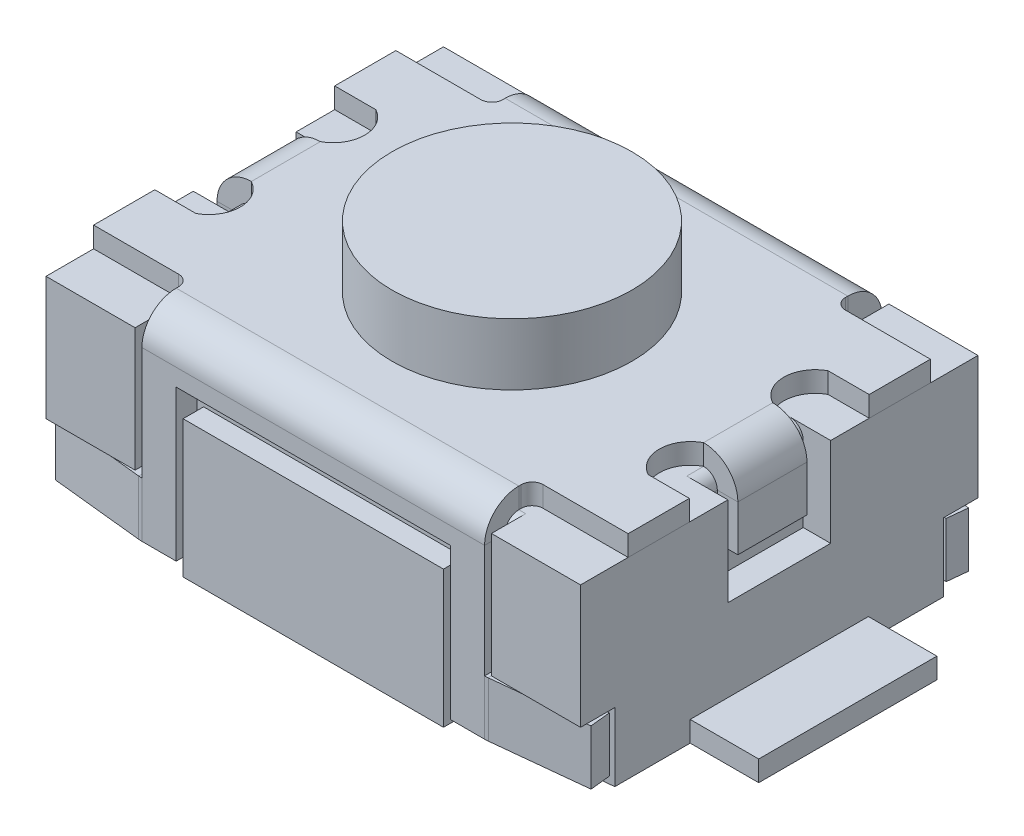
from build123d import *
from OCP.BRepFilletAPI import BRepFilletAPI_MakeChamfer

# Parameters (mm, degrees)
SKETCH1_W                   = 3.9
SKETCH1_H                   = 2.9
BOSS_EXTRUDE1_DEPTH         = 1.4
SKETCH2_R                   = 0.875
BOSS_EXTRUDE2_DEPTH         = 0.6
SKETCH3_W                   = 1
SKETCH3_H                   = 0.5
CUT_EXTRUDE1_DEPTH          = 0.15
CHAMFER1_SIZE               = 0.1
CHAMFER1_SIZE_2             = 1
CHAMFER2_SIZE               = 1
CHAMFER2_SIZE_2             = 0.1
CUT_EXTRUDE_DEPTH           = 0.15
SKETCH5_W                   = 0.4
SKETCH5_H                   = 0.75
CUT_EXTRUDE2_DEPTH          = 0.65
FILLET1_R                   = 0.1
BOSS_EXTRUDE3_DEPTH         = 0.15
SKETCHED_START              = -1.25
SKETCHED_BEND1_DEPTH        = 2.5
SKETCHED_START_2            = -1.95
SKETCHED_BEND1_2_OUTLINE_W  = 0.4
SKETCHED_BEND1_2_OUTLINE_H  = 0.15
SKETCHED_BEND1_2_DEPTH      = 0.95
SKETCHED_START_3            = 1
SKETCHED_BEND1_3_OUTLINE_W  = 0.4
SKETCHED_BEND1_3_OUTLINE_H  = 0.15
SKETCHED_BEND1_3_DEPTH      = 0.95
SKETCHED_BEND1_4_OUTLINE_W  = 0.7
SKETCHED_BEND1_4_OUTLINE_H  = 0.15
SKETCHED_BEND1_4_DEPTH      = 0.25
SKETCHED_BEND1_5_OUTLINE_W  = 0.7
SKETCHED_BEND1_5_OUTLINE_H  = 0.15
SKETCHED_BEND1_5_DEPTH      = 0.25
SKETCHED_START_4            = -0.252028138
SKETCHED_BEND1_6_DEPTH      = 0.504056276
SKETCHED_BEND1_7_DEPTH      = 3.9
SKETCHED_START_5            = -2.258673163
SKETCHED_BEND1_8_OUTLINE_W  = 0.15
SKETCHED_BEND1_8_OUTLINE_H  = 0.504056276
SKETCHED_BEND1_8_DEPTH      = 0.358673163
SKETCHED_START_6            = 1.9
SKETCHED_BEND1_9_OUTLINE_W  = 0.15
SKETCHED_BEND1_9_OUTLINE_H  = 0.504056276
SKETCHED_BEND1_9_DEPTH      = 0.358673163
SKETCHED_START_7            = -2.7
SKETCHED_BEND1_10_OUTLINE_W = 3.9
SKETCHED_BEND1_10_OUTLINE_H = 0.15
SKETCHED_BEND1_10_DEPTH     = 1.25
SKETCHED_START_8            = 1.45
SKETCHED_BEND1_11_OUTLINE_W = 3.9
SKETCHED_BEND1_11_OUTLINE_H = 0.15
SKETCHED_BEND1_11_DEPTH     = 1.25
SKETCHED_BEND1_12_DEPTH     = 0.504056276
SKETCHED_START_9            = 0.074889357
SKETCHED_BEND6_DEPTH        = 0.4
SKETCHED_BEND6_2_DEPTH      = 0.4
SKETCHED_BEND3_DEPTH        = 0.4
SKETCHED_BEND3_2_DEPTH      = 0.4
SKETCH10_W                  = 0.5
SKETCH10_H                  = 1.3
CUT_EXTRUDE3_DEPTH          = 0.15
SKETCH11_W                  = 0.75
SKETCH11_H                  = 1.3
BOSS_EXTRUDE4_DEPTH         = 0.15
BOSS_EXTRUDE4_2_DEPTH       = 0.15


# Read off the part's stored shape, not the designer's step: Sketched Bend1, Sketched Bend6, Sketched Bend3
# Some blends are built 0.0001 mm under size
with BuildPart() as part:
    # Sketch1 → Boss-Extrude1 (new body)
    with BuildSketch(Plane(origin=(0, 0, 0), x_dir=(1, 0, 0), z_dir=(0, 1, 0))):
        Rectangle(SKETCH1_W, SKETCH1_H)
    extrude(amount=BOSS_EXTRUDE1_DEPTH)

    # Sketch2 → Boss-Extrude2 (add)
    with BuildSketch(Plane(origin=(0, 1.4, 0), x_dir=(1, 0, 0), z_dir=(0, 1, 0))):
        with Locations(Location((0, 0, 0), (0, 0, 90))):
            Circle(SKETCH2_R)
    extrude(amount=BOSS_EXTRUDE2_DEPTH)

    # Sketch3 → Cut-Extrude1 (cut)
    with BuildSketch(Plane.XY.offset(1.45)):
        with Locations((1.45, 0.25)):
            Rectangle(SKETCH3_W, SKETCH3_H)
        with Locations((-1.45, 0.25)):
            Rectangle(SKETCH3_W, SKETCH3_H)
    cut_extrude1 = extrude(amount=-CUT_EXTRUDE1_DEPTH, mode=Mode.SUBTRACT)

    # Mirror1: Cut-Extrude1 across plane
    add(cut_extrude1.mirror(Plane.XY), mode=Mode.SUBTRACT)

    # Chamfer1
    # the kernel refuses this chamfer: 1, 0.1 mm, written as the material it takes off along each edge
    with BuildSketch(Plane(origin=(1.95, 0.5, 1.3), x_dir=(0.3574851447578448, 0, -0.9339188247794681), z_dir=(0, -1, 0))) as chamfer1_piece_1:
        Polygon((CHAMFER1_SIZE * 0.933918824779, -CHAMFER1_SIZE * 0.357485144758), (-CHAMFER1_SIZE_2 * 0.357485144758, -CHAMFER1_SIZE_2 * 0.933918824779), (0, 0), align=None)
    extrude(amount=3.099522763, mode=Mode.SUBTRACT)
    with BuildSketch(Plane(origin=(-1.95, 0.5, 1.3), x_dir=(-0.3574851447578448, 0, -0.9339188247794681), z_dir=(0, -1, 0))) as chamfer1_piece_2:
        Polygon((CHAMFER1_SIZE * 0.933918824779, CHAMFER1_SIZE * 0.357485144758), (-CHAMFER1_SIZE_2 * 0.357485144758, CHAMFER1_SIZE_2 * 0.933918824779), (0, 0), align=None)
    extrude(amount=3.099522763, mode=Mode.SUBTRACT)

    # Chamfer2
    chamfer2_edges_1 = [part.edges().sort_by_distance(p)[0] for p in [
        (1.95, 0.25, -1.3),
    ]]
    chamfer2_side_1 = [part.faces().sort_by_distance(p)[0] for p in [
        (1.948, 0.25, -1.3),
    ]]
    chamfer2_edges_2 = [part.edges().sort_by_distance(p)[0] for p in [
        (-1.95, 0.25, -1.3),
    ]]
    chamfer2_side_2 = [part.faces().sort_by_distance(p)[0] for p in [
        (-1.95, 0.25, -1.298),
    ]]
    chamfer2 = BRepFilletAPI_MakeChamfer(part.part.solid().wrapped)
    for e in chamfer2_edges_1:
        chamfer2.Add(CHAMFER2_SIZE - 0.0001, CHAMFER2_SIZE_2 - 0.0001, e.wrapped, chamfer2_side_1[0].wrapped)
    for e in chamfer2_edges_2:
        chamfer2.Add(CHAMFER2_SIZE_2 - 0.0001, CHAMFER2_SIZE - 0.0001, e.wrapped, chamfer2_side_2[0].wrapped)
    add(Compound.cast(chamfer2.Shape()), mode=Mode.REPLACE)  # a hair under: the kernel refuses the full size

    # Sketch4 → Cut-Extrude (cut)
    with BuildSketch(Plane.XY.offset(1.45)):
        Polygon((-1.3, 1.4), (1.3, 1.4), (1.3, 0.5), (0.95, 0.5), (0.95, 1), (-0.95, 1), (-0.95, 0.5), (-1.3, 0.5), align=None)
    cut_extrude = extrude(amount=-CUT_EXTRUDE_DEPTH, mode=Mode.SUBTRACT)

    # Mirror6: Cut-Extrude across plane
    add(cut_extrude.mirror(Plane.XY), mode=Mode.SUBTRACT)

    # Sketch5 → Cut-Extrude2 (cut)
    with BuildSketch(Plane(origin=(0, 1.4, 0), x_dir=(1, 0, 0), z_dir=(0, 1, 0))):
        with Locations((-1.95, 0)):
            Rectangle(SKETCH5_W, SKETCH5_H)
    cut_extrude2 = extrude(amount=-CUT_EXTRUDE2_DEPTH, mode=Mode.SUBTRACT)

    # Mirror2: Cut-Extrude2 across plane
    add(cut_extrude2.mirror(Plane(origin=(0, 0, 0), x_dir=(0, 0, 1), z_dir=(1, 0, 0))), mode=Mode.SUBTRACT)

    # Fillet1
    fillet1_edges = [part.edges().sort_by_distance(p)[0] for p in [
        (0, 1.4, 1.3),
        (0, 1.4, -1.3),
        (-1.75, 1.4, 0),
        (1.75, 1.4, 0),
    ]]
    fillet(fillet1_edges, radius=FILLET1_R)

    # Sketch10 → Cut-Extrude3 (cut)
    with BuildSketch(Plane(origin=(0, 0, 0), x_dir=(-1, 0, 0), z_dir=(0, -1, 0))):
        with Locations((1.95, 0)):
            Rectangle(SKETCH10_W, SKETCH10_H)
        with Locations((-1.95, 0)):
            Rectangle(SKETCH10_W, SKETCH10_H)
    extrude(amount=-CUT_EXTRUDE3_DEPTH, mode=Mode.SUBTRACT)


with BuildPart() as body_2:
    # Sketch6 → Boss-Extrude3 (new body)
    with BuildSketch(Plane(origin=(0, 1.4, 0), x_dir=(1, 0, 0), z_dir=(0, 1, 0))):
        with BuildLine():
            Line((1.25, 1.2), (1.25, 2.3))
            Line((1.25, 2.3), (1.95, 2.3))
            Line((1.95, 2.3), (1.95, 2.7))
            Line((1.95, 2.7), (1, 2.7))
            Line((1, 2.7), (1, 1.6))
            Line((1, 1.6), (-1, 1.6))
            Line((-1, 1.6), (-1, 2.7))
            Line((-1, 2.7), (-1.95, 2.7))
            Line((-1.95, 2.7), (-1.95, 2.3))
            Line((-1.95, 2.3), (-1.25, 2.3))
            Line((-1.25, 2.3), (-1.25, 1.2))
            Line((-1.25, 1.2), (-1.25, 1.182641483))
            ThreePointArc((-1.25, 1.182641483), (-1.273431458, 1.126072941), (-1.33, 1.102641483))
            Line((-1.33, 1.102641483), (-1.95, 1.102641483))
            Line((-1.95, 1.102641483), (-1.95, 0.656190297))
            Line((-1.95, 0.656190297), (-1.65, 0.656190297))
            ThreePointArc((-1.65, 0.656190297), (-1.528818532, 0.454109218), (-1.65, 0.252028138))
            Line((-1.65, 0.252028138), (-2.258673163, 0.252028138))
            Line((-2.258673163, 0.252028138), (-2.258673163, -0.252028138))
            Line((-2.258673163, -0.252028138), (-1.65, -0.252028138))
            ThreePointArc((-1.65, -0.252028138), (-1.528818532, -0.454109218), (-1.65, -0.656190297))
            Line((-1.65, -0.656190297), (-1.95, -0.656190297))
            Line((-1.95, -0.656190297), (-1.95, -1.102641483))
            Line((-1.95, -1.102641483), (-1.33, -1.102641483))
            ThreePointArc((-1.33, -1.102641483), (-1.273431458, -1.126072941), (-1.25, -1.182641483))
            Line((-1.25, -1.182641483), (-1.25, -1.2))
            Line((-1.25, -1.2), (-1.25, -2.3))
            Line((-1.25, -2.3), (-1.95, -2.3))
            Line((-1.95, -2.3), (-1.95, -2.7))
            Line((-1.95, -2.7), (-1, -2.7))
            Line((-1, -2.7), (-1, -1.6))
            Line((-1, -1.6), (1, -1.6))
            Line((1, -1.6), (1, -2.7))
            Line((1, -2.7), (1.95, -2.7))
            Line((1.95, -2.7), (1.95, -2.3))
            Line((1.95, -2.3), (1.25, -2.3))
            Line((1.25, -2.3), (1.25, -1.2))
            Line((1.25, -1.2), (1.25, -1.182641483))
            ThreePointArc((1.25, -1.182641483), (1.273431458, -1.126072941), (1.33, -1.102641483))
            Line((1.33, -1.102641483), (1.95, -1.102641483))
            Line((1.95, -1.102641483), (1.95, -0.656190297))
            Line((1.95, -0.656190297), (1.65, -0.656190297))
            ThreePointArc((1.65, -0.656190297), (1.528818532, -0.454109218), (1.65, -0.252028138))
            Line((1.65, -0.252028138), (2.258673163, -0.252028138))
            Line((2.258673163, -0.252028138), (2.258673163, 0.252028138))
            Line((2.258673163, 0.252028138), (1.65, 0.252028138))
            ThreePointArc((1.65, 0.252028138), (1.528818532, 0.454109218), (1.65, 0.656190297))
            Line((1.65, 0.656190297), (1.95, 0.656190297))
            Line((1.95, 0.656190297), (1.95, 1.102641483))
            Line((1.95, 1.102641483), (1.33, 1.102641483))
            ThreePointArc((1.33, 1.102641483), (1.273431458, 1.126072941), (1.25, 1.182641483))
            Line((1.25, 1.182641483), (1.25, 1.2))
        make_face()
    extrude(amount=BOSS_EXTRUDE3_DEPTH)

    # Sketched Bend1 outline → Sketched Bend1 (add)
    with BuildSketch(Plane.YZ.offset(SKETCHED_START)):
        with BuildLine():
            Line((1.4, 1.2), (1.4, 1.429128784))
            ThreePointArc((1.4, 1.429128784), (1.351077411, 1.444726578), (1.3, 1.45))
            Line((1.3, 1.45), (1.174889357, 1.45))
            Line((1.174889357, 1.45), (1.174889357, 1.3))
            Line((1.174889357, 1.3), (1.3, 1.3))
            ThreePointArc((1.3, 1.3), (1.370710678, 1.270710678), (1.4, 1.2))
        make_face()
        with BuildLine():
            Line((1.4, -1.429128784), (1.4, -1.2))
            ThreePointArc((1.4, -1.2), (1.370710678, -1.270710678), (1.3, -1.3))
            Line((1.3, -1.3), (1.174889357, -1.3))
            Line((1.174889357, -1.3), (1.174889357, -1.45))
            Line((1.174889357, -1.45), (1.3, -1.45))
            ThreePointArc((1.3, -1.45), (1.351077411, -1.444726578), (1.4, -1.429128784))
        make_face()
    extrude(amount=SKETCHED_BEND1_DEPTH)

    # Sketched Bend1 2 outline → Sketched Bend1 2 (add)
    with BuildSketch(Plane.YZ.offset(SKETCHED_START_2)):
        with Locations((0.274889357, 1.375)):
            Rectangle(SKETCHED_BEND1_2_OUTLINE_W, SKETCHED_BEND1_2_OUTLINE_H)
        with Locations((0.274889357, -1.375)):
            Rectangle(SKETCHED_BEND1_2_OUTLINE_W, SKETCHED_BEND1_2_OUTLINE_H)
    extrude(amount=SKETCHED_BEND1_2_DEPTH)

    # Sketched Bend1 3 outline → Sketched Bend1 3 (add)
    with BuildSketch(Plane.YZ.offset(SKETCHED_START_3)):
        with Locations((0.274889357, 1.375)):
            Rectangle(SKETCHED_BEND1_3_OUTLINE_W, SKETCHED_BEND1_3_OUTLINE_H)
        with Locations((0.274889357, -1.375)):
            Rectangle(SKETCHED_BEND1_3_OUTLINE_W, SKETCHED_BEND1_3_OUTLINE_H)
    extrude(amount=SKETCHED_BEND1_3_DEPTH)

    # Sketched Bend1 4 outline → Sketched Bend1 4 (add)
    with BuildSketch(Plane.YZ.offset(SKETCHED_START)):
        with Locations((0.824889357, 1.375)):
            Rectangle(SKETCHED_BEND1_4_OUTLINE_W, SKETCHED_BEND1_4_OUTLINE_H)
        with Locations((0.824889357, -1.375)):
            Rectangle(SKETCHED_BEND1_4_OUTLINE_W, SKETCHED_BEND1_4_OUTLINE_H)
    extrude(amount=SKETCHED_BEND1_4_DEPTH)

    # Sketched Bend1 5 outline → Sketched Bend1 5 (add)
    with BuildSketch(Plane.YZ.offset(SKETCHED_START_3)):
        with Locations((0.824889357, 1.375)):
            Rectangle(SKETCHED_BEND1_5_OUTLINE_W, SKETCHED_BEND1_5_OUTLINE_H)
        with Locations((0.824889357, -1.375)):
            Rectangle(SKETCHED_BEND1_5_OUTLINE_W, SKETCHED_BEND1_5_OUTLINE_H)
    extrude(amount=SKETCHED_BEND1_5_DEPTH)

    # Sketched Bend1 6 outline → Sketched Bend1 6 (add)
    with BuildSketch(Plane.XY.offset(SKETCHED_START_4)):
        with BuildLine():
            ThreePointArc((1.9, 1.3), (1.894726578, 1.351077411), (1.879128784, 1.4))
            Line((1.879128784, 1.4), (1.65, 1.4))
            ThreePointArc((1.65, 1.4), (1.720710678, 1.370710678), (1.75, 1.3))
            Line((1.75, 1.3), (1.75, 0.966216194))
            Line((1.75, 0.966216194), (1.9, 0.966216194))
            Line((1.9, 0.966216194), (1.9, 1.3))
        make_face()
        with BuildLine():
            Line((-1.65, 1.4), (-1.879128784, 1.4))
            ThreePointArc((-1.879128784, 1.4), (-1.894726578, 1.351077411), (-1.9, 1.3))
            Line((-1.9, 1.3), (-1.9, 0.966216194))
            Line((-1.9, 0.966216194), (-1.75, 0.966216194))
            Line((-1.75, 0.966216194), (-1.75, 1.3))
            ThreePointArc((-1.75, 1.3), (-1.720710678, 1.370710678), (-1.65, 1.4))
        make_face()
    extrude(amount=SKETCHED_BEND1_6_DEPTH)

    # Sketched Bend1 7 outline → Sketched Bend1 7 (cut)
    with BuildSketch(Plane.YZ.offset(SKETCHED_START_2)):
        with BuildLine():
            ThreePointArc((1.4, 1.429128784), (1.509165006, 1.336930639), (1.55, 1.2))
            Line((1.55, 1.2), (1.55, 2.7))
            Line((1.55, 2.7), (1.4, 2.7))
            Line((1.4, 2.7), (1.4, 1.429128784))
        make_face()
        with BuildLine():
            ThreePointArc((1.55, -1.2), (1.509165006, -1.336930639), (1.4, -1.429128784))
            Line((1.4, -1.429128784), (1.4, -2.7))
            Line((1.4, -2.7), (1.55, -2.7))
            Line((1.55, -2.7), (1.55, -1.2))
        make_face()
    extrude(amount=SKETCHED_BEND1_7_DEPTH, mode=Mode.SUBTRACT)

    # Sketched Bend1 8 outline → Sketched Bend1 8 (cut)
    with BuildSketch(Plane.YZ.offset(SKETCHED_START_5)):
        with Locations((1.475, 0)):
            Rectangle(SKETCHED_BEND1_8_OUTLINE_W, SKETCHED_BEND1_8_OUTLINE_H)
    extrude(amount=SKETCHED_BEND1_8_DEPTH, mode=Mode.SUBTRACT)

    # Sketched Bend1 9 outline → Sketched Bend1 9 (cut)
    with BuildSketch(Plane.YZ.offset(SKETCHED_START_6)):
        with Locations((1.475, 0)):
            Rectangle(SKETCHED_BEND1_9_OUTLINE_W, SKETCHED_BEND1_9_OUTLINE_H)
    extrude(amount=SKETCHED_BEND1_9_DEPTH, mode=Mode.SUBTRACT)

    # Sketched Bend1 10 outline → Sketched Bend1 10 (cut)
    with BuildSketch(Plane.XY.offset(SKETCHED_START_7)):
        with Locations((0, 1.475)):
            Rectangle(SKETCHED_BEND1_10_OUTLINE_W, SKETCHED_BEND1_10_OUTLINE_H)
    extrude(amount=SKETCHED_BEND1_10_DEPTH, mode=Mode.SUBTRACT)

    # Sketched Bend1 11 outline → Sketched Bend1 11 (cut)
    with BuildSketch(Plane.XY.offset(SKETCHED_START_8)):
        with Locations((0, 1.475)):
            Rectangle(SKETCHED_BEND1_11_OUTLINE_W, SKETCHED_BEND1_11_OUTLINE_H)
    extrude(amount=SKETCHED_BEND1_11_DEPTH, mode=Mode.SUBTRACT)

    # Sketched Bend1 12 outline → Sketched Bend1 12 (cut)
    with BuildSketch(Plane.XY.offset(SKETCHED_START_4)):
        with BuildLine():
            ThreePointArc((1.65, 1.55), (1.786930639, 1.509165006), (1.879128784, 1.4))
            Line((1.879128784, 1.4), (2.258673163, 1.4))
            Line((2.258673163, 1.4), (2.258673163, 1.55))
            Line((2.258673163, 1.55), (1.65, 1.55))
        make_face()
        with BuildLine():
            ThreePointArc((-1.879128784, 1.4), (-1.786930639, 1.509165006), (-1.65, 1.55))
            Line((-1.65, 1.55), (-2.258673163, 1.55))
            Line((-2.258673163, 1.55), (-2.258673163, 1.4))
            Line((-2.258673163, 1.4), (-1.879128784, 1.4))
        make_face()
    extrude(amount=SKETCHED_BEND1_12_DEPTH, mode=Mode.SUBTRACT)

    # Sketched Bend6 outline → Sketched Bend6 (cut)
    with BuildSketch(Plane(origin=(0, 0, 0), x_dir=(1, 0, 0), z_dir=(0, 1, 0)).offset(SKETCHED_START_9)):
        with BuildLine():
            Line((-1.95, -1.45), (-1.25, -1.45))
            ThreePointArc((-1.25, -1.45), (-1.263083989, -1.449657384), (-1.276132116, -1.448630474))
            Line((-1.276132116, -1.448630474), (-1.95, -1.377804106))
            Line((-1.95, -1.377804106), (-1.95, -1.45))
        make_face()
        with BuildLine():
            ThreePointArc((1.276132116, -1.448630474), (1.263083989, -1.449657384), (1.25, -1.45))
            Line((1.25, -1.45), (1.95, -1.45))
            Line((1.95, -1.45), (1.95, -1.377804106))
            Line((1.95, -1.377804106), (1.276132116, -1.448630474))
        make_face()
        Polygon((-1.95, -1.3), (-1.95, -1.338634813), (-1.945939317, -1.3), align=None)
        Polygon((1.945939317, -1.3), (1.95, -1.338634813), (1.95, -1.3), align=None)
    extrude(amount=SKETCHED_BEND6_DEPTH, mode=Mode.SUBTRACT)

    # Sketched Bend6 2 outline → Sketched Bend6 2 (add)
    with BuildSketch(Plane(origin=(0, 0, 0), x_dir=(1, 0, 0), z_dir=(0, 1, 0)).offset(SKETCHED_START_9)):
        Polygon((-1.954071877, -1.377376134), (-1.95, -1.377804106), (-1.95, -1.338634813), align=None)
        Polygon((1.95, -1.338634813), (1.95, -1.377804106), (1.954071877, -1.377376134), align=None)
        with BuildLine():
            Line((-1.938392607, -1.228197849), (-1.945939317, -1.3))
            Line((-1.945939317, -1.3), (-1.25, -1.3))
            ThreePointArc((-1.25, -1.3), (-1.255233595, -1.299862953), (-1.260452846, -1.29945219))
            Line((-1.260452846, -1.29945219), (-1.938392607, -1.228197849))
        make_face()
        with BuildLine():
            Line((1.25, -1.3), (1.945939317, -1.3))
            Line((1.945939317, -1.3), (1.938392607, -1.228197849))
            Line((1.938392607, -1.228197849), (1.260452846, -1.29945219))
            ThreePointArc((1.260452846, -1.29945219), (1.255233595, -1.299862953), (1.25, -1.3))
        make_face()
    extrude(amount=SKETCHED_BEND6_2_DEPTH)

    # Sketched Bend3 outline → Sketched Bend3 (cut)
    with BuildSketch(Plane(origin=(0, 0, 0), x_dir=(1, 0, 0), z_dir=(0, 1, 0)).offset(SKETCHED_START_9)):
        with BuildLine():
            ThreePointArc((-1.276132116, 1.448630474), (-1.263083989, 1.449657384), (-1.25, 1.45))
            Line((-1.25, 1.45), (-1.95, 1.45))
            Line((-1.95, 1.45), (-1.95, 1.377804106))
            Line((-1.95, 1.377804106), (-1.276132116, 1.448630474))
        make_face()
        with BuildLine():
            Line((1.95, 1.45), (1.25, 1.45))
            ThreePointArc((1.25, 1.45), (1.263083989, 1.449657384), (1.276132116, 1.448630474))
            Line((1.276132116, 1.448630474), (1.95, 1.377804106))
            Line((1.95, 1.377804106), (1.95, 1.45))
        make_face()
        Polygon((-1.945939317, 1.3), (-1.95, 1.338634813), (-1.95, 1.3), align=None)
        Polygon((1.95, 1.3), (1.95, 1.338634813), (1.945939317, 1.3), align=None)
    extrude(amount=SKETCHED_BEND3_DEPTH, mode=Mode.SUBTRACT)

    # Sketched Bend3 2 outline → Sketched Bend3 2 (add)
    with BuildSketch(Plane(origin=(0, 0, 0), x_dir=(1, 0, 0), z_dir=(0, 1, 0)).offset(SKETCHED_START_9)):
        Polygon((-1.95, 1.338634813), (-1.95, 1.377804106), (-1.954071877, 1.377376134), align=None)
        Polygon((1.954071877, 1.377376134), (1.95, 1.377804106), (1.95, 1.338634813), align=None)
        with BuildLine():
            Line((-1.25, 1.3), (-1.945939317, 1.3))
            Line((-1.945939317, 1.3), (-1.938392607, 1.228197849))
            Line((-1.938392607, 1.228197849), (-1.260452846, 1.29945219))
            ThreePointArc((-1.260452846, 1.29945219), (-1.255233595, 1.299862953), (-1.25, 1.3))
        make_face()
        with BuildLine():
            Line((1.938392607, 1.228197849), (1.945939317, 1.3))
            Line((1.945939317, 1.3), (1.25, 1.3))
            ThreePointArc((1.25, 1.3), (1.255233595, 1.299862953), (1.260452846, 1.29945219))
            Line((1.260452846, 1.29945219), (1.938392607, 1.228197849))
        make_face()
    extrude(amount=SKETCHED_BEND3_2_DEPTH)


with BuildPart() as body_3:
    # Sketch11 → Boss-Extrude4 (new body)
    with BuildSketch(Plane.XZ):
        with Locations((-2.075, 0)):
            Rectangle(SKETCH11_W, SKETCH11_H)
    extrude(amount=-BOSS_EXTRUDE4_DEPTH)


with BuildPart() as body_4:
    # Sketch11 → Boss-Extrude4 2 (new body)
    with BuildSketch(Plane.XZ):
        with Locations((2.075, 0)):
            Rectangle(SKETCH11_W, SKETCH11_H)
    extrude(amount=-BOSS_EXTRUDE4_2_DEPTH)


solid = Compound([part.part, body_2.part, body_3.part, body_4.part])
